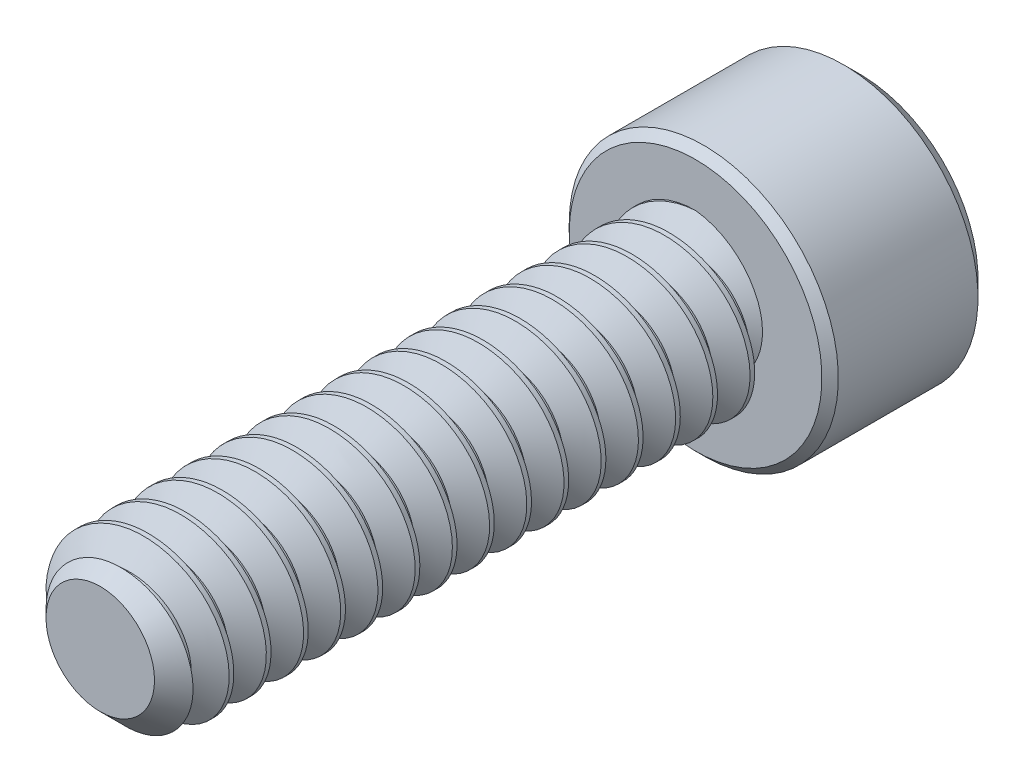
from build123d import *

# Parameters (mm, degrees)
SKETCH1_R          = 1.7526
EXTRUDE1_DEPTH     = 12.7
CHAMFER3_SIZE      = 0.5953125
CUT_SWEEP1_PITCH   = 0.79375
SKETCH6_R          = 2.8702
EXTRUDE2_DEPTH     = 3.5052
CUT_EXTRUDE1_DEPTH = 2.08359375
SKETCH8_R          = 1.603951217
CUT_EXTRUDE2_DEPTH = 0.35052
CUT_EXTRUDE2_DRAFT = -45
CHAMFER1_SIZE      = 0.35052
CHAMFER2_SIZE      = 0.17526


with BuildPart() as part:
    # Sketch1 → Extrude1 (new body)
    with BuildSketch(Plane.XY):
        Circle(SKETCH1_R)
    extrude(amount=-EXTRUDE1_DEPTH)

    # Chamfer3
    chamfer3_edges = [part.edges().sort_by_distance(p)[0] for p in [
        (-1.7526, 0, 0),
    ]]
    chamfer(chamfer3_edges, length=CHAMFER3_SIZE)

    # Cut-Sweep1: the profile of Sketch3 profile screwed along a right-hand helix of 17 turns, 6 arcs to a turn; built about Z, then put on its axis
    cut_sweep1_z = Axis((0, 0, 0), (0, 0, 1))
    cut_sweep1_corners = [(1.7529, 0, -0.694704455), (1.237044252, 0, -0.396875), (1.237044252, 0, -0.29765625), (1.7529, 0, 0.000173205)]
    with BuildLine(mode=Mode.PRIVATE) as cut_sweep1_profile:
        Line(cut_sweep1_corners[0], cut_sweep1_corners[1])
        Line(cut_sweep1_corners[1], cut_sweep1_corners[2])
        Line(cut_sweep1_corners[2], cut_sweep1_corners[3])
        Line(cut_sweep1_corners[3], cut_sweep1_corners[0])
    cut_sweep1_cap = Face(cut_sweep1_profile.wire())
    cut_sweep1_turn_angles = [0, 30, 60, 90, 120, 150, 180, 210, 240, 270, 300, 330, 360]
    cut_sweep1_turn_weights = [1, 0.8660254037844387, 1, 0.8660254037844387, 1, 0.8660254037844387, 1, 0.8660254037844387, 1, 0.8660254037844387, 1, 0.8660254037844387, 1]
    cut_sweep1_turn_rails = [Edge.make_bspline([Vector(p[0], p[1], 0).rotate(cut_sweep1_z, cut_sweep1_turn_angles[k]) / cut_sweep1_turn_weights[k] + Vector(0, 0, p[2] + CUT_SWEEP1_PITCH * cut_sweep1_turn_angles[k] / 360) for k in range(13)], [0, 0, 0, 1, 1, 2, 2, 3, 3, 4, 4, 5, 5, 6, 6, 6], 2, cut_sweep1_turn_weights) for p in cut_sweep1_corners]
    cut_sweep1_turn_sides = [Face.make_surface_from_curves(cut_sweep1_turn_rails[p[0]], cut_sweep1_turn_rails[p[1]]) for p in [(0, 1), (1, 2), (2, 3), (3, 0)]]
    cut_sweep1 = Plane(origin=(0, 0, 0), x_dir=(0, 1, 0), z_dir=(0, 0, -1)) * Solid(Shell([*[p.moved(Location((0, 0, CUT_SWEEP1_PITCH * i))) for i in range(17) for p in cut_sweep1_turn_sides], cut_sweep1_cap, cut_sweep1_cap.rotate(cut_sweep1_z, 6120).moved(Location((0, 0, CUT_SWEEP1_PITCH * 6120 / 360)))]))
    add(cut_sweep1, mode=Mode.SUBTRACT)

    # Sketch6 → Extrude2 (add)
    with BuildSketch(Plane(origin=(0, 0, -12.7), x_dir=(-1, 0, 0), z_dir=(0, 0, -1))):
        Circle(SKETCH6_R)
    extrude(amount=EXTRUDE2_DEPTH)

    # Sketch7 → Cut-Extrude1 (cut)
    with BuildSketch(Plane(origin=(0, 0, -16.2052), x_dir=(-1, 0, 0), z_dir=(0, 0, -1))):
        Polygon((0, 1.603951217), (-1.3890625, 0.801975608), (-1.3890625, -0.801975608), (0, -1.603951217), (1.3890625, -0.801975608), (1.3890625, 0.801975608), align=None)
    extrude(amount=-CUT_EXTRUDE1_DEPTH, mode=Mode.SUBTRACT)


with BuildPart() as cut_extrude2_tool:
    # Sketch8 → Cut-Extrude2 (with draft: the straight prism first)
    with BuildSketch(Plane(origin=(0, 0, -16.2052), x_dir=(-1, 0, 0), z_dir=(0, 0, -1))):
        Circle(SKETCH8_R)
    extrude(amount=-CUT_EXTRUDE2_DEPTH)
    # Cut-Extrude2: the draft: its side faces are tilted about the plane it starts from
    cut_extrude2_sides = [cut_extrude2_tool.faces().sort_by_distance(p)[0] for p in [
        (1.603951217, 0, -16.02994),
    ]]
    draft(cut_extrude2_sides, Plane(origin=(0, 0, -16.2052), x_dir=(-1, 0, 0), z_dir=(0, 0, -1)), CUT_EXTRUDE2_DRAFT)


with BuildPart() as part_1:
    add(part.part)

    # Cut-Extrude2: cut by cut_extrude2_tool
    add(cut_extrude2_tool.part, mode=Mode.SUBTRACT)

    # Chamfer1
    chamfer1_edges = [part_1.edges().sort_by_distance(p)[0] for p in [
        (2.8702, 0, -16.2052),
    ]]
    chamfer(chamfer1_edges, length=CHAMFER1_SIZE)

    # Chamfer2
    chamfer2_edges = [part_1.edges().sort_by_distance(p)[0] for p in [
        (2.8702, 0, -12.7),
    ]]
    chamfer(chamfer2_edges, length=CHAMFER2_SIZE)


solid = part_1.part
